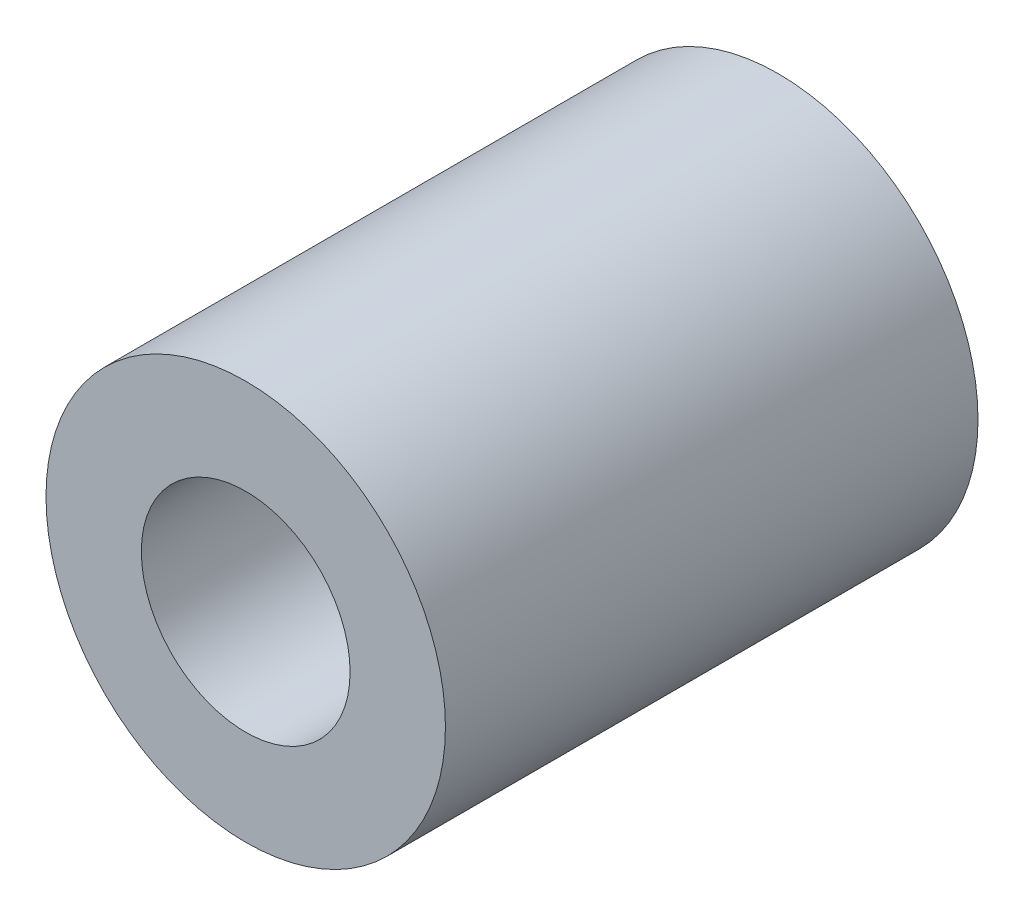
from build123d import *

# Parameters (mm, degrees)
SKETCH1_R           = 4.7625
SKETCH1_R_2         = 2.4892
BOSS_EXTRUDE1_DEPTH = 12.7


with BuildPart() as part:
    # Sketch1 → Boss-Extrude1 (new body)
    with BuildSketch(Plane.XY):
        Circle(SKETCH1_R)
        Circle(SKETCH1_R_2, mode=Mode.SUBTRACT)
    extrude(amount=BOSS_EXTRUDE1_DEPTH)


solid = part.part
